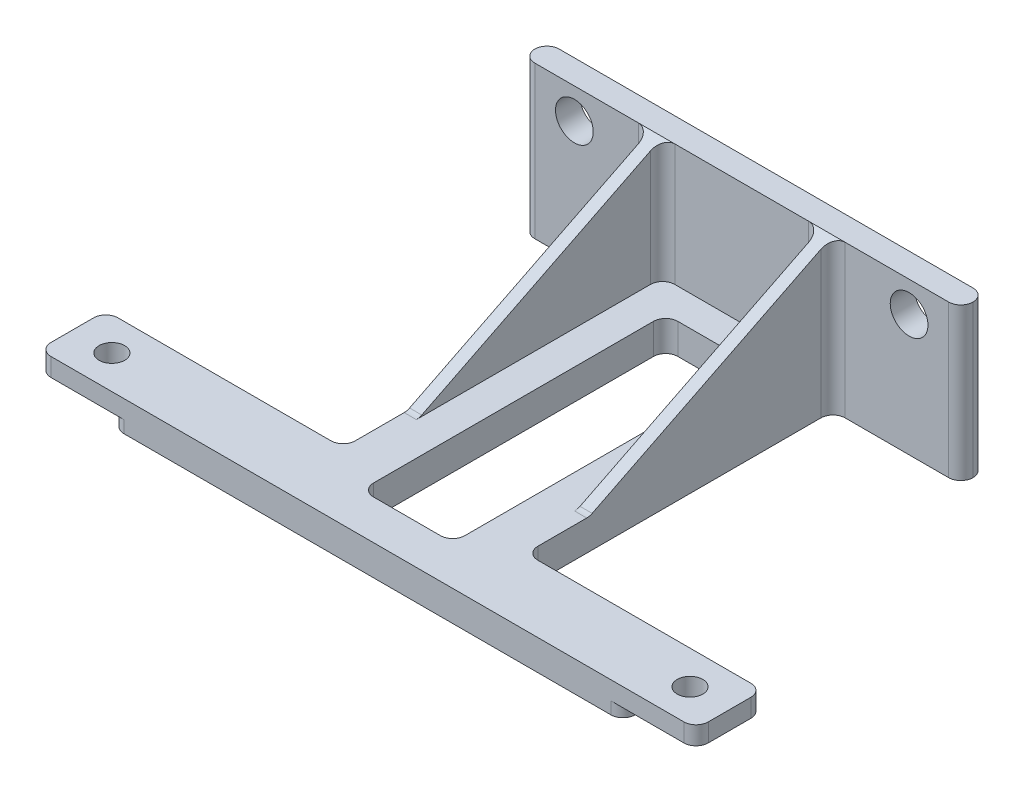
from build123d import *

# Parameters (mm, degrees)
SKETCH_1_W          = 72
SKETCH_1_H          = 25
SKETCH_1_R          = 3.1
EXTRUDE_1_DEPTH     = 4
EXTRUDE_START       = -4
SKETCH_3_W          = 30
SKETCH_3_H          = 5
EXTRUDE_2_DEPTH     = 60
SKETCH_5_W          = 108
SKETCH_5_H          = 11
SKETCH_5_R          = 2.1
EXTRUDE_3_DEPTH     = 5
CUT_EXTRUDE_START   = -5
SKETCH_6_W          = 12
SKETCH_6_H          = 11
CUT_EXTRUDE_1_DEPTH = 2
SKETCH_7_W          = 15
SKETCH_7_H          = 50
CUT_EXTRUDE_2_DEPTH = 88.213817713
EXTRUDE_4_DEPTH     = 2
EXTRUDE_START_2     = -30
EXTRUDE_5_DEPTH     = 2
FILLET_1_R          = 2


with BuildPart() as part:
    # 草图1 → 凸台-拉伸1 (new body)
    with BuildSketch(Plane.XY):
        Rectangle(SKETCH_1_W, SKETCH_1_H)
        with Locations((-27.5, 7.5)):
            Circle(SKETCH_1_R, mode=Mode.SUBTRACT)
        with Locations(Location((27.5, 7.5, 0), (0, 0, 180))):
            Circle(SKETCH_1_R, mode=Mode.SUBTRACT)
    extrude(amount=EXTRUDE_1_DEPTH)

    # 草图3 → 凸台-拉伸2 (add)
    with BuildSketch(Plane.XY.offset(4).offset(EXTRUDE_START)):
        with Locations((0, -10)):
            Rectangle(SKETCH_3_W, SKETCH_3_H)
    extrude(amount=EXTRUDE_2_DEPTH)

    # 草图5 → 凸台-拉伸3 (add, through all)
    with BuildSketch(Plane(origin=(0, -7.5, 0), x_dir=(1, 0, 0), z_dir=(0, 1, 0))):
        with Locations((0, -60)):
            Rectangle(SKETCH_5_W, SKETCH_5_H)
        with Locations(Location((47.5, -60, 0), (0, 0, 270))):
            Circle(SKETCH_5_R, mode=Mode.SUBTRACT)
        with Locations(Location((-47.5, -60, 0), (0, 0, 90))):
            Circle(SKETCH_5_R, mode=Mode.SUBTRACT)
    extrude(amount=-EXTRUDE_3_DEPTH)

    # 草图6 → 切除-拉伸1 (cut)
    with BuildSketch(Plane(origin=(0, -7.5, 0), x_dir=(1, 0, 0), z_dir=(0, 1, 0)).offset(CUT_EXTRUDE_START)):
        with Locations((-48, -60)):
            Rectangle(SKETCH_6_W, SKETCH_6_H)
        with Locations((48, -60)):
            Rectangle(SKETCH_6_W, SKETCH_6_H)
    extrude(amount=CUT_EXTRUDE_1_DEPTH, mode=Mode.SUBTRACT)

    # 草图7 → 切除-拉伸2 (cut, through all)
    with BuildSketch(Plane(origin=(0, -7.5, 0), x_dir=(1, 0, 0), z_dir=(0, 1, 0))):
        with Locations((0, -34)):
            Rectangle(SKETCH_7_W, SKETCH_7_H)
    extrude(amount=-CUT_EXTRUDE_2_DEPTH, mode=Mode.SUBTRACT)

    # 草图8 → 凸台-拉伸4 (add)
    with BuildSketch(Plane.ZY.offset(15)):
        Polygon((4, -7.5), (44, -7.5), (4, 12.5), align=None)
    extrude(amount=-EXTRUDE_4_DEPTH)

    # 草图8<2> → 凸台-拉伸5 (add)
    with BuildSketch(Plane.ZY.offset(15).offset(EXTRUDE_START_2)):
        Polygon((4, -7.5), (44, -7.5), (4, 12.5), align=None)
    extrude(amount=EXTRUDE_5_DEPTH)

    # 圆角1
    fillet_1_edges = [part.edges().sort_by_distance(p)[0] for p in [
        (15, 0, 4),
        (36, 0, 4),
        (36, 0, 0),
        (-36, 0, 0),
        (-36, 0, 4),
        (-15, -10, 54.5),
        (-54, -9, 54.5),
        (-54, -9, 65.5),
        (54, -9, 65.5),
        (54, -9, 54.5),
        (15, -10, 54.5),
        (-15, 0, 4),
        (-42, -11.5, 54.5),
        (42, -11.5, 54.5),
        (42, -11.5, 65.5),
        (-42, -11.5, 65.5),
        (-7.5, -10, 59),
        (-7.5, -10, 9),
        (7.5, -10, 59),
        (7.5, -10, 9),
        (14, -7.5, 44),
        (-14, -7.5, 44),
        (-13, 2.5, 4),
        (13, 2.5, 4),
    ]]
    fillet(fillet_1_edges, radius=FILLET_1_R - 0.0001)  # a hair under: the kernel refuses the full size


solid = part.part
